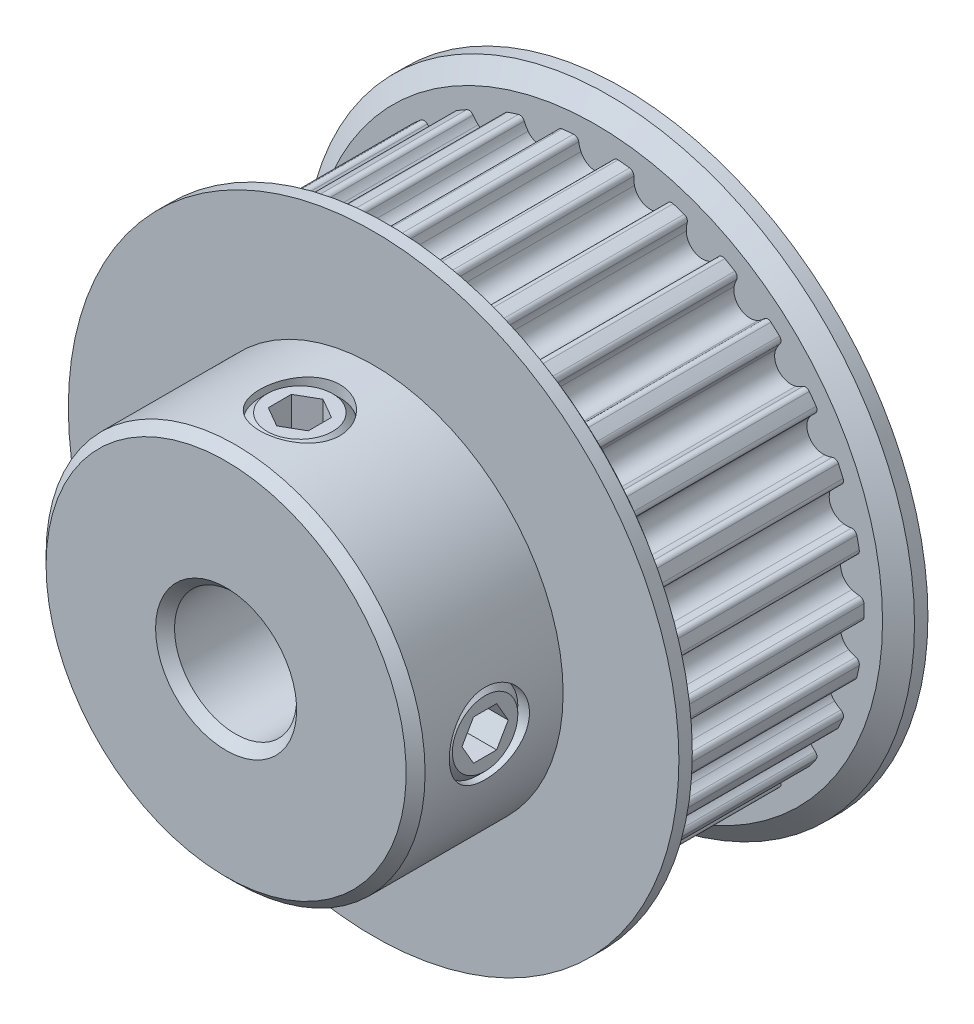
from build123d import *

# Parameters (mm, degrees)
CUT_EXTRUDE1_START = 1.245
CUT_EXTRUDE1_DEPTH = 10.16
CIRPATTERN1_COUNT  = 30
SKETCH4_R          = 2.0828
CUT_EXTRUDE2_DEPTH = 25.704804189
CUT_EXTRUDE3_DEPTH = 1.5621
CIRPATTERN2_COUNT  = 2
CIRPATTERN2_ANGLE  = 90
CHAMFER1_SIZE      = 0.49275


with BuildPart() as part:
    # Sketch2 → Revolve1 (revolve)
    with BuildSketch(Plane(origin=(0, 0, 0), x_dir=(0, 0, -1), z_dir=(1, 0, 0)), mode=Mode.PRIVATE) as revolve1_sk:
        Polygon((-10.31, 3.175), (10.31, 3.175), (10.31, 15.875), (9.6125, 15.875), (8.915, 14.90975), (8.915, 13.9445), (-1.245, 13.9445), (-1.245, 14.90975), (-1.9425, 15.875), (-2.64, 15.875), (-2.64, 9.855), (-10.31, 9.855), align=None)
    revolve(revolve1_sk.sketch.rotate(Axis((0, 0, 10.31), (0, 0, -1)), 90), axis=Axis((0, 0, 10.31), (0, 0, -1)))

    # Sketch3 → Cut-Extrude1 (cut)
    with BuildSketch(Plane.XY.offset(CUT_EXTRUDE1_START)):
        with BuildLine():
            Line((3.380339503, 15.875), (-3.380339503, 15.875))
            Line((-3.380339503, 15.875), (-2.904159709, 13.638729289))
            ThreePointArc((-2.904159709, 13.638729289), (-2.035039237, 13.795205528), (-1.157757061, 13.896354876))
            ThreePointArc((-1.157757061, 13.896354876), (-0.983100831, 13.844232952), (-0.890249054, 13.68738895))
            ThreePointArc((-0.890249054, 13.68738895), (-0.844821344, 13.491293192), (-0.773880597, 13.302919538))
            ThreePointArc((-0.773880597, 13.302919538), (0, 12.8045), (0.773880597, 13.302919538))
            ThreePointArc((0.773880597, 13.302919538), (0.844821344, 13.491293192), (0.890249054, 13.68738895))
            ThreePointArc((0.890249054, 13.68738895), (0.983100831, 13.844232952), (1.157757061, 13.896354876))
            ThreePointArc((1.157757061, 13.896354876), (2.035039237, 13.795205528), (2.904159709, 13.638729289))
            Line((2.904159709, 13.638729289), (3.380339503, 15.875))
        make_face()
    cut_extrude1 = extrude(amount=-CUT_EXTRUDE1_DEPTH, mode=Mode.SUBTRACT)

    # CirPattern1: Cut-Extrude1 ×30 about axis
    cirpattern1_axis = Axis((0, 0, 0), (0, 0, 1))
    for i in range(1, CIRPATTERN1_COUNT):
        add(cut_extrude1.rotate(cirpattern1_axis, i * 360 / CIRPATTERN1_COUNT), mode=Mode.SUBTRACT)

    # Sketch4 → Cut-Extrude2 (cut, through all)
    with BuildSketch(Plane(origin=(0, 0, 0), x_dir=(0, -1, 0), z_dir=(1, 0, 0))):
        with Locations(Location((0, -6.475, 0), (0, 0, 270))):
            Circle(SKETCH4_R)
    cut_extrude2 = extrude(amount=CUT_EXTRUDE2_DEPTH, mode=Mode.SUBTRACT)

    # Sketch5 → Revolve2 (revolve)
    with BuildSketch(Plane.XY.offset(6.475)):
        Polygon((3.175, -1.7018), (3.175, 0), (9.632391664, 0), (9.632391664, -1.7018), (9.251391664, -2.0828), (3.556, -2.0828), align=None)
    revolve2 = revolve(axis=Axis((3.175, 0, 6.475), (1, 0, 0)))

    # Sketch6 → Cut-Extrude3 (cut)
    with BuildSketch(Plane(origin=(9.632391664, 5.384140679, 0), x_dir=(0, -1, 0), z_dir=(-1, 0, 0))):
        Polygon((5.384140679, 7.677505141), (4.342740679, 7.07625257), (4.342740679, 5.87374743), (5.384140679, 5.272494859), (6.425540679, 5.87374743), (6.425540679, 7.07625257), align=None)
    cut_extrude3 = extrude(amount=CUT_EXTRUDE3_DEPTH, mode=Mode.SUBTRACT)

    # CirPattern2: Cut-Extrude2, Revolve2, Cut-Extrude3 ×2 about axis
    cirpattern2_axis = Axis((0, 0, 0), (0, 0, 1))
    add([cut_extrude2.rotate(cirpattern2_axis, i * CIRPATTERN2_ANGLE / (CIRPATTERN2_COUNT - 1)) for i in range(1, CIRPATTERN2_COUNT)], mode=Mode.SUBTRACT)
    add([revolve2.rotate(cirpattern2_axis, i * CIRPATTERN2_ANGLE / (CIRPATTERN2_COUNT - 1)) for i in range(1, CIRPATTERN2_COUNT)])
    add([cut_extrude3.rotate(cirpattern2_axis, i * CIRPATTERN2_ANGLE / (CIRPATTERN2_COUNT - 1)) for i in range(1, CIRPATTERN2_COUNT)], mode=Mode.SUBTRACT)

    # Chamfer1
    chamfer1_edges = [part.edges().sort_by_distance(p)[0] for p in [
        (-9.855, 0, 10.31),
        (-3.175, 0, 10.31),
    ]]
    chamfer(chamfer1_edges, length=CHAMFER1_SIZE)


solid = part.part
